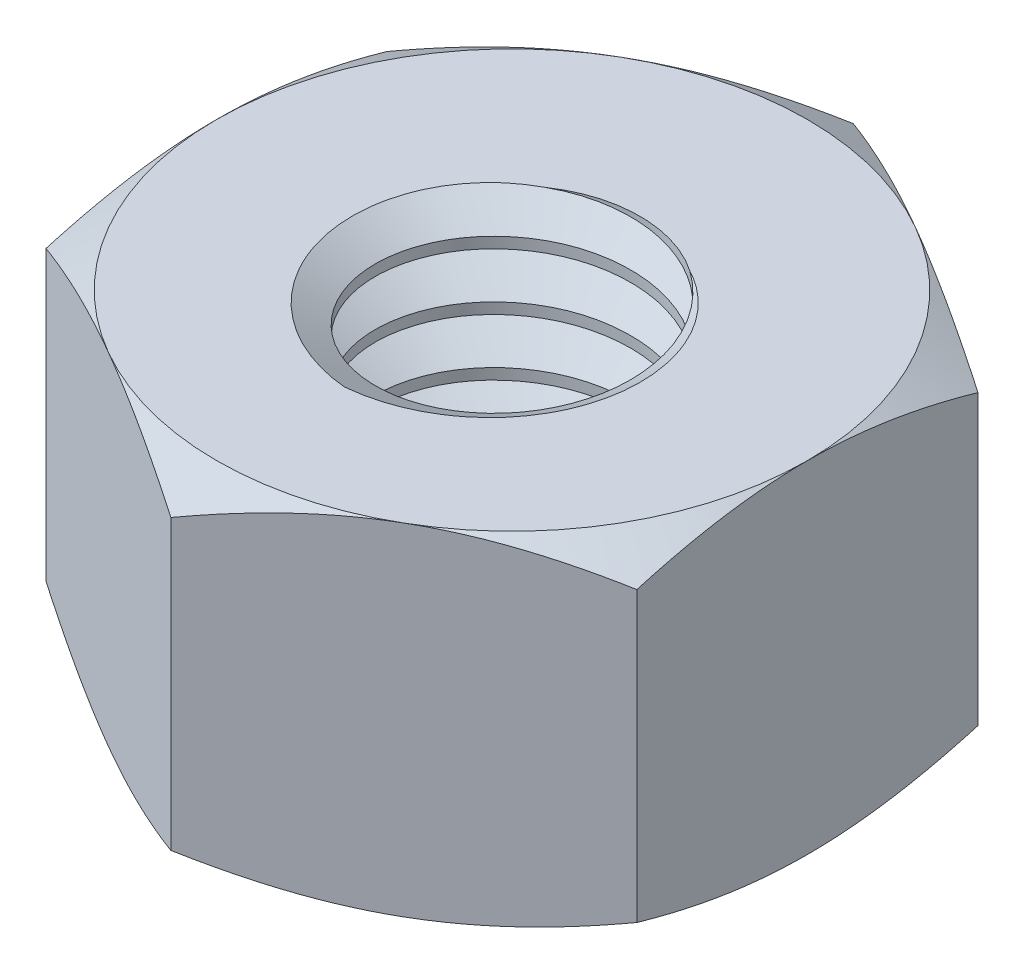
from build123d import *

# Parameters (mm, degrees)
SKETCH1_R               = 4.5
BOSS_EXTRUDE1_DEPTH     = 6
SKETCH2_OUTSIDE_W       = 71.142
SKETCH2_OUTSIDE_H       = 74.358
SKETCH2_OUTSIDE_R       = 10.392304845
CUT_EXTRUDE1_DEPTH      = 12
CUT_EXTRUDE1_DRAFT      = -60
MIRROR1_COPY_1_SKETCH_W = 71.142
MIRROR1_COPY_1_SKETCH_H = 74.358
MIRROR1_COPY_1_SKETCH_R = 10.392304845
MIRROR1_COPY_1_DEPTH    = 12
MIRROR1_COPY_1_DRAFT    = -60
CUT_SWEEP1_PITCH        = 2


with BuildPart() as part:
    # Sketch1 → Boss-Extrude1 (new, symmetric)
    with BuildSketch(Plane(origin=(0, 0, 0), x_dir=(1, 0, 0), z_dir=(0, 1, 0))):
        Polygon((0, 12), (-10.392304845, 6), (-10.392304845, -6), (0, -12), (10.392304845, -6), (10.392304845, 6), align=None)
        with Locations(Location((0, 0, 0), (0, 0, 270))):
            Circle(SKETCH1_R, mode=Mode.SUBTRACT)
    extrude(amount=BOSS_EXTRUDE1_DEPTH, both=True)


with BuildPart() as cut_extrude1_tool:
    # Sketch2 outside → Cut-Extrude1 (with draft: the straight prism first)
    with BuildSketch(Plane(origin=(0, 6, 0), x_dir=(1, 0, 0), z_dir=(0, 1, 0))):
        Rectangle(SKETCH2_OUTSIDE_W, SKETCH2_OUTSIDE_H)
        Circle(SKETCH2_OUTSIDE_R, mode=Mode.SUBTRACT)
    extrude(amount=-CUT_EXTRUDE1_DEPTH)
    # Cut-Extrude1: the draft: its side faces are tilted about the plane it starts from
    cut_extrude1_sides = [cut_extrude1_tool.faces().sort_by_distance(p)[0] for p in [
        (0, 0, 37.179),
        (35.571, 0, 0),
        (0, 0, -37.179),
        (-35.571, 0, 0),
        (-10.392304845, 0, 0),
    ]]
    draft(cut_extrude1_sides, Plane(origin=(0, 6, 0), x_dir=(1, 0, 0), z_dir=(0, 1, 0)), CUT_EXTRUDE1_DRAFT)


with BuildPart() as part_1:
    add(part.part)

    # Cut-Extrude1: cut by cut_extrude1_tool
    add(cut_extrude1_tool.part, mode=Mode.SUBTRACT)


with BuildPart() as mirror1_copy_1_tool:
    # Mirror1 copy 1 sketch → Mirror1 copy 1 (with draft: the straight prism first)
    with BuildSketch(Plane.XZ.offset(6)):
        Rectangle(MIRROR1_COPY_1_SKETCH_W, MIRROR1_COPY_1_SKETCH_H)
        Circle(MIRROR1_COPY_1_SKETCH_R, mode=Mode.SUBTRACT)
    extrude(amount=-MIRROR1_COPY_1_DEPTH)
    # Mirror1 copy 1: the draft: its side faces are tilted about the plane it starts from
    mirror1_copy_1_sides = [mirror1_copy_1_tool.faces().sort_by_distance(p)[0] for p in [
        (0, 0, 37.179),
        (35.571, 0, 0),
        (0, 0, -37.179),
        (-35.571, 0, 0),
        (-10.392304845, 0, 0),
    ]]
    draft(mirror1_copy_1_sides, Plane.XZ.offset(6), MIRROR1_COPY_1_DRAFT)


with BuildPart() as part_2:
    add(part_1.part)

    # Mirror1 copy 1: cut by mirror1_copy_1_tool
    add(mirror1_copy_1_tool.part, mode=Mode.SUBTRACT)

    # Cut-Sweep1: arcs per turn and ends read off the stored shape
    # Cut-Sweep1: the profile of Sketch5 screwed along a right-hand helix through 8 turns, 10 arcs to a turn; built about Z, then put on its axis
    cut_sweep1_z = Axis((0, 0, 0), (0, 0, 1))
    cut_sweep1_corners = [(5.9, 0, -2), (3.8, 0, -0.787564435), (3.8, 0, -3.212435565)]
    with BuildLine(mode=Mode.PRIVATE) as cut_sweep1_profile:
        Line(cut_sweep1_corners[0], cut_sweep1_corners[1])
        Line(cut_sweep1_corners[1], cut_sweep1_corners[2])
        Line(cut_sweep1_corners[2], cut_sweep1_corners[0])
    cut_sweep1_cap = Face(cut_sweep1_profile.wire())
    cut_sweep1_turn_angles = [0, 18, 36, 54, 72, 90, 108, 126, 144, 162, 180, 198, 216, 234, 252, 270, 288, 306, 324, 342, 360]
    cut_sweep1_turn_weights = [1, 0.9510565162951535, 1, 0.9510565162951535, 1, 0.9510565162951535, 1, 0.9510565162951535, 1, 0.9510565162951535, 1, 0.9510565162951535, 1, 0.9510565162951535, 1, 0.9510565162951535, 1, 0.9510565162951535, 1, 0.9510565162951535, 1]
    cut_sweep1_turn_rails = [Edge.make_bspline([Vector(p[0], p[1], 0).rotate(cut_sweep1_z, cut_sweep1_turn_angles[k]) / cut_sweep1_turn_weights[k] + Vector(0, 0, p[2] + CUT_SWEEP1_PITCH * cut_sweep1_turn_angles[k] / 360) for k in range(21)], [0, 0, 0, 1, 1, 2, 2, 3, 3, 4, 4, 5, 5, 6, 6, 7, 7, 8, 8, 9, 9, 10, 10, 10], 2, cut_sweep1_turn_weights) for p in cut_sweep1_corners]
    cut_sweep1_turn_sides = [Face.make_surface_from_curves(cut_sweep1_turn_rails[p[0]], cut_sweep1_turn_rails[p[1]]) for p in [(0, 1), (1, 2), (2, 0)]]
    cut_sweep1 = Plane(origin=(0, 6, 0), x_dir=(0, 0, 1), z_dir=(0, -1, 0)) * Solid(Shell([*[p.moved(Location((0, 0, CUT_SWEEP1_PITCH * i))) for i in range(8) for p in cut_sweep1_turn_sides], cut_sweep1_cap, cut_sweep1_cap.rotate(cut_sweep1_z, 2880).moved(Location((0, 0, CUT_SWEEP1_PITCH * 2880 / 360)))]))
    add(cut_sweep1, mode=Mode.SUBTRACT)


solid = part_2.part
